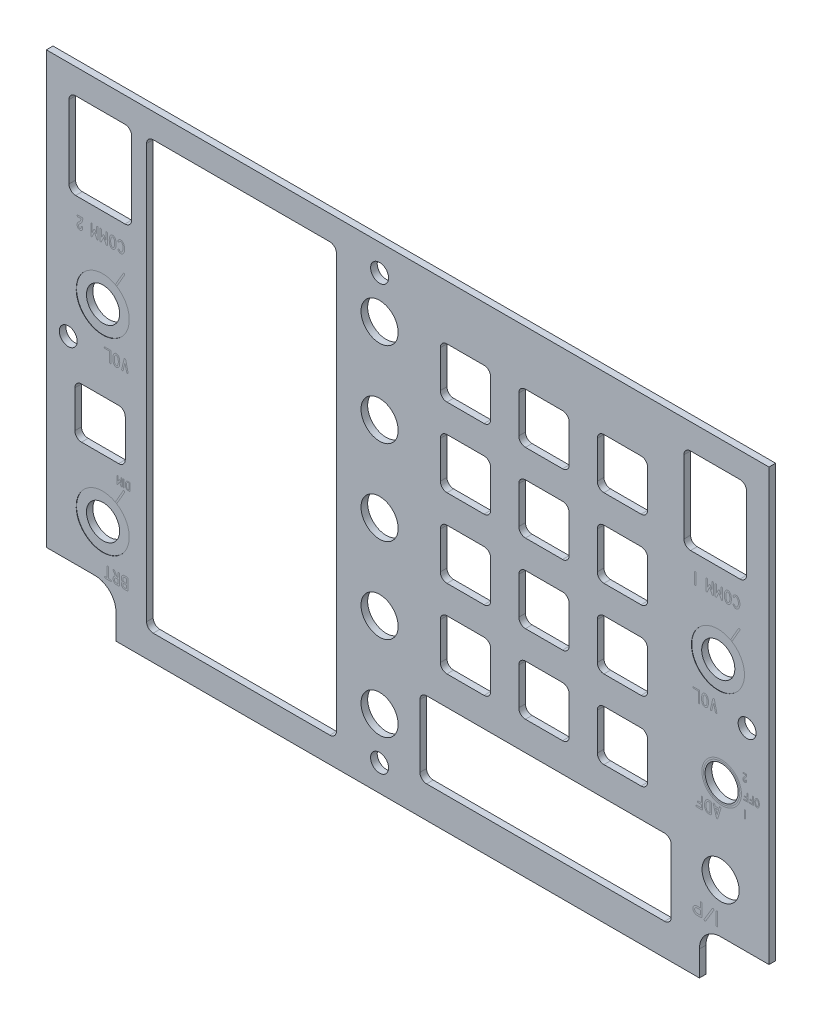
from build123d import *

# Parameters (mm, degrees)
BOSS_EXTRUDE1_DEPTH   = 1.5875
SKETCH3_R             = 4.445
SKETCH3_W             = 12.065
SKETCH3_H             = 12.065
CUT_EXTRUDE1_DEPTH    = 202.731272774
SKETCH4_R             = 3.96875
CUT_EXTRUDE2_DEPTH    = 202.731272774
SKETCH5_W             = 11.94
SKETCH5_H             = 20.64
SKETCH5_W_2           = 45.462
SKETCH5_H_2           = 102.32
SKETCH5_W_3           = 60.175
SKETCH5_H_3           = 18.275
CUT_EXTRUDE3_DEPTH    = 202.731272774
F_6_CLEARANCE_HOLE2_D = 4.3053
CUT_EXTRUDE4_START    = -1.5875
SKETCH11_W            = 15
SKETCH11_H            = 20.64
CUT_EXTRUDE4_DEPTH    = 1.5875
CUT_EXTRUDE6_START    = -0.033045
SKETCH13_W            = 15
SKETCH13_H            = 1.5875
CUT_EXTRUDE6_DEPTH    = 0.033045
FILLET1_START         = -0.0762
FILLET1_OUTLINE_R     = 6.35
FILLET1_OUTLINE_R_2   = 3.96875
FILLET1_DEPTH         = 0.0762
FILLET1_START_2       = -1.5875
FILLET1_2_DEPTH       = 1.5875


with BuildPart() as part:
    # Sketch1 → Boss-Extrude1 (new body)
    with BuildSketch(Plane.XY):
        with BuildLine():
            Line((74.93, -171.1167297), (86.51875, -171.1167297))
            Line((86.51875, -171.1167297), (86.51875, -67.9292297))
            Line((86.51875, -67.9292297), (-86.51875, -67.9292297))
            Line((-86.51875, -67.9292297), (-86.51875, -171.1167297))
            Line((-86.51875, -171.1167297), (-74.93, -171.1167297))
            ThreePointArc((-74.93, -171.1167297), (-71.337897552, -172.604627251), (-69.85, -176.1967297))
            Line((-69.85, -176.1967297), (-69.85, -182.2292297))
            Line((-69.85, -182.2292297), (69.85, -182.2292297))
            Line((69.85, -182.2292297), (69.85, -176.1967297))
            ThreePointArc((69.85, -176.1967297), (71.337897552, -172.604627251), (74.93, -171.1167297))
        make_face()
    extrude(amount=-BOSS_EXTRUDE1_DEPTH)

    # Sketch3 → Cut-Extrude1 (cut, through all)
    with BuildSketch(Plane.XY):
        with Locations((74.93, -159.3692297)):
            Circle(SKETCH3_R)
        with Locations((-6.731, -165.7192297)):
            Circle(SKETCH3_R)
        with Locations((-6.731, -145.3992297)):
            Circle(SKETCH3_R)
        with Locations((-6.731, -125.0792297)):
            Circle(SKETCH3_R)
        with Locations((-6.731, -104.7592297)):
            Circle(SKETCH3_R)
        with Locations((-6.731, -84.4392297)):
            Circle(SKETCH3_R)
        with Locations((-73.66, -139.0492297)):
            Rectangle(SKETCH3_W, SKETCH3_H)
        with Locations((13.843, -143.3672297)):
            Rectangle(SKETCH3_W, SKETCH3_H)
        with Locations((32.639, -143.3672297)):
            Rectangle(SKETCH3_W, SKETCH3_H)
        with Locations((51.435, -143.3672297)):
            Rectangle(SKETCH3_W, SKETCH3_H)
        with Locations((51.435, -124.5712297)):
            Rectangle(SKETCH3_W, SKETCH3_H)
        with Locations((32.639, -124.5712297)):
            Rectangle(SKETCH3_W, SKETCH3_H)
        with Locations((13.843, -124.5712297)):
            Rectangle(SKETCH3_W, SKETCH3_H)
        with Locations((13.843, -105.7752297)):
            Rectangle(SKETCH3_W, SKETCH3_H)
        with Locations((13.843, -86.9792297)):
            Rectangle(SKETCH3_W, SKETCH3_H)
        with Locations((32.639, -86.9792297)):
            Rectangle(SKETCH3_W, SKETCH3_H)
        with Locations((32.639, -105.7752297)):
            Rectangle(SKETCH3_W, SKETCH3_H)
        with Locations((51.435, -105.7752297)):
            Rectangle(SKETCH3_W, SKETCH3_H)
        with Locations((51.435, -86.9792297)):
            Rectangle(SKETCH3_W, SKETCH3_H)
    extrude(amount=-CUT_EXTRUDE1_DEPTH, mode=Mode.SUBTRACT)

    # Sketch4 → Cut-Extrude2 (cut, through all)
    with BuildSketch(Plane.XY):
        with Locations((-73.025, -113.9667297)):
            Circle(SKETCH4_R)
        with Locations((-73.025, -159.0517297)):
            Circle(SKETCH4_R)
        with Locations((74.295, -113.9667297)):
            Circle(SKETCH4_R)
        with Locations((75.184, -139.0492297)):
            Circle(SKETCH4_R)
    extrude(amount=-CUT_EXTRUDE2_DEPTH, mode=Mode.SUBTRACT)

    # Sketch5 → Cut-Extrude3 (cut, through all)
    with BuildSketch(Plane.XY):
        with Locations((-73.66, -84.3122297)):
            Rectangle(SKETCH5_W, SKETCH5_H)
        with Locations((73.66, -84.3122297)):
            Rectangle(SKETCH5_W, SKETCH5_H)
        with Locations((-39.799, -124.9522297)):
            Rectangle(SKETCH5_W_2, SKETCH5_H_2)
        with Locations((33.02, -165.4922297)):
            Rectangle(SKETCH5_W_3, SKETCH5_H_3)
    extrude(amount=-CUT_EXTRUDE3_DEPTH, mode=Mode.SUBTRACT)

    # #6 Clearance Hole2 (through all)
    with Locations(Plane(origin=(0, 0, 0), x_dir=(-1, 0, 0), z_dir=(0, 0, 1))):
        with Locations((-81.28, 124.6982297), (6.731, 175.8792297), (81.28, 124.6982297), (6.731, 74.2792297)):
            Hole(F_6_CLEARANCE_HOLE2_D / 2)

    # Sketch11 → Cut-Extrude4 (cut)
    with BuildSketch(Plane(origin=(0, 0, -1.5875), x_dir=(-1, 0, 0), z_dir=(0, 0, -1)).offset(CUT_EXTRUDE4_START)):
        with Locations((73.612537257, -84.279184845)):
            Rectangle(SKETCH11_W, SKETCH11_H)
        with Locations((-73.648214902, -84.3122297)):
            Rectangle(SKETCH11_W, SKETCH11_H)
    extrude(amount=CUT_EXTRUDE4_DEPTH, mode=Mode.SUBTRACT)

    # Sketch13 → Cut-Extrude6 (cut)
    with BuildSketch(Plane(origin=(0, -94.599184845, 0), x_dir=(1, 0, 0), z_dir=(0, 1, 0)).offset(CUT_EXTRUDE6_START)):
        with Locations((-73.612537257, 0.79375)):
            Rectangle(SKETCH13_W, SKETCH13_H)
    extrude(amount=CUT_EXTRUDE6_DEPTH, mode=Mode.SUBTRACT)

    # Fillet1: read off the stored shape, not the designer's step
    # Fillet1 outline → Fillet1 (cut)
    # profile 1 of 3: a face of its own
    with BuildSketch(Plane.XY.offset(FILLET1_START)):
        with Locations((74.295, -113.9667297)):
            Circle(FILLET1_OUTLINE_R)
        with Locations((74.295, -113.9667297)):
            Circle(FILLET1_OUTLINE_R_2, mode=Mode.SUBTRACT)
    # profile 2 of 3: a face of its own
    with BuildSketch(Plane.XY.offset(FILLET1_START)):
        with Locations((-73.025, -159.0517297)):
            Circle(FILLET1_OUTLINE_R)
        with Locations((-73.025, -159.0517297)):
            Circle(FILLET1_OUTLINE_R_2, mode=Mode.SUBTRACT)
    # profile 3 of 3: a face of its own
    with BuildSketch(Plane.XY.offset(FILLET1_START)):
        with Locations((-73.025, -113.9667297)):
            Circle(FILLET1_OUTLINE_R)
        with Locations((-73.025, -113.9667297)):
            Circle(FILLET1_OUTLINE_R_2, mode=Mode.SUBTRACT)
    extrude(amount=FILLET1_DEPTH, mode=Mode.SUBTRACT)

    # Fillet1 2 outline → Fillet1 2 (add)
    with BuildSketch(Plane.XY.offset(FILLET1_START_2)):
        with BuildLine():
            Line((63.1075, -174.6297297), (63.1075, -173.0422297))
            ThreePointArc((63.1075, -173.0422297), (62.642532015, -174.164761715), (61.52, -174.6297297))
            Line((61.52, -174.6297297), (63.1075, -174.6297297))
        make_face()
        with BuildLine():
            ThreePointArc((61.52, -156.3547297), (62.642532015, -156.819697685), (63.1075, -157.9422297))
            Line((63.1075, -157.9422297), (63.1075, -156.3547297))
            Line((63.1075, -156.3547297), (61.52, -156.3547297))
        make_face()
        with BuildLine():
            Line((2.9325, -174.6297297), (4.52, -174.6297297))
            ThreePointArc((4.52, -174.6297297), (3.397467985, -174.164761715), (2.9325, -173.0422297))
            Line((2.9325, -173.0422297), (2.9325, -174.6297297))
        make_face()
        with BuildLine():
            ThreePointArc((2.9325, -157.9422297), (3.397467985, -156.819697685), (4.52, -156.3547297))
            Line((4.52, -156.3547297), (2.9325, -156.3547297))
            Line((2.9325, -156.3547297), (2.9325, -157.9422297))
        make_face()
        with BuildLine():
            Line((-79.6925, -145.0817297), (-78.105, -145.0817297))
            ThreePointArc((-78.105, -145.0817297), (-79.227532015, -144.616761715), (-79.6925, -143.4942297))
            Line((-79.6925, -143.4942297), (-79.6925, -145.0817297))
        make_face()
        with BuildLine():
            ThreePointArc((-67.6275, -143.4942297), (-68.092467985, -144.616761715), (-69.215, -145.0817297))
            Line((-69.215, -145.0817297), (-67.6275, -145.0817297))
            Line((-67.6275, -145.0817297), (-67.6275, -143.4942297))
        make_face()
        with BuildLine():
            Line((-79.6925, -133.0167297), (-79.6925, -134.6042297))
            ThreePointArc((-79.6925, -134.6042297), (-79.227532015, -133.481697685), (-78.105, -133.0167297))
            Line((-78.105, -133.0167297), (-79.6925, -133.0167297))
        make_face()
        with BuildLine():
            ThreePointArc((-69.215, -133.0167297), (-68.092467985, -133.481697685), (-67.6275, -134.6042297))
            Line((-67.6275, -134.6042297), (-67.6275, -133.0167297))
            Line((-67.6275, -133.0167297), (-69.215, -133.0167297))
        make_face()
        with BuildLine():
            ThreePointArc((-67.700037257, -73.959184845), (-66.577505242, -74.42415283), (-66.112537257, -75.546684845))
            Line((-66.112537257, -75.546684845), (-66.112537257, -73.959184845))
            Line((-66.112537257, -73.959184845), (-67.700037257, -73.959184845))
        make_face()
        with BuildLine():
            Line((-66.112537257, -94.6322297), (-66.112537257, -93.0447297))
            ThreePointArc((-66.112537257, -93.0447297), (-66.577505242, -94.167261715), (-67.700037257, -94.6322297))
            Line((-67.700037257, -94.6322297), (-66.112537257, -94.6322297))
        make_face()
        with BuildLine():
            ThreePointArc((-81.112537257, -75.546684845), (-80.647569272, -74.42415283), (-79.525037257, -73.959184845))
            Line((-79.525037257, -73.959184845), (-81.112537257, -73.959184845))
            Line((-81.112537257, -73.959184845), (-81.112537257, -75.546684845))
        make_face()
        with BuildLine():
            Line((-81.112537257, -94.6322297), (-79.525037257, -94.6322297))
            ThreePointArc((-79.525037257, -94.6322297), (-80.647569272, -94.167261715), (-81.112537257, -93.0447297))
            Line((-81.112537257, -93.0447297), (-81.112537257, -94.6322297))
        make_face()
        with BuildLine():
            ThreePointArc((79.560714902, -73.9922297), (80.683246917, -74.457197685), (81.148214902, -75.5797297))
            Line((81.148214902, -75.5797297), (81.148214902, -73.9922297))
            Line((81.148214902, -73.9922297), (79.560714902, -73.9922297))
        make_face()
        with BuildLine():
            Line((81.148214902, -94.6322297), (81.148214902, -93.0447297))
            ThreePointArc((81.148214902, -93.0447297), (80.683246917, -94.167261715), (79.560714902, -94.6322297))
            Line((79.560714902, -94.6322297), (81.148214902, -94.6322297))
        make_face()
        with BuildLine():
            ThreePointArc((66.148214902, -75.5797297), (66.613182887, -74.457197685), (67.735714902, -73.9922297))
            Line((67.735714902, -73.9922297), (66.148214902, -73.9922297))
            Line((66.148214902, -73.9922297), (66.148214902, -75.5797297))
        make_face()
        with BuildLine():
            Line((66.148214902, -94.6322297), (67.735714902, -94.6322297))
            ThreePointArc((67.735714902, -94.6322297), (66.613182887, -94.167261715), (66.148214902, -93.0447297))
            Line((66.148214902, -93.0447297), (66.148214902, -94.6322297))
        make_face()
        with BuildLine():
            Line((7.8105, -137.3347297), (7.8105, -138.9222297))
            ThreePointArc((7.8105, -138.9222297), (8.275467985, -137.799697685), (9.398, -137.3347297))
            Line((9.398, -137.3347297), (7.8105, -137.3347297))
        make_face()
        with BuildLine():
            ThreePointArc((9.398, -149.3997297), (8.275467985, -148.934761715), (7.8105, -147.8122297))
            Line((7.8105, -147.8122297), (7.8105, -149.3997297))
            Line((7.8105, -149.3997297), (9.398, -149.3997297))
        make_face()
        with BuildLine():
            Line((19.8755, -137.3347297), (18.288, -137.3347297))
            ThreePointArc((18.288, -137.3347297), (19.410532015, -137.799697685), (19.8755, -138.9222297))
            Line((19.8755, -138.9222297), (19.8755, -137.3347297))
        make_face()
        with BuildLine():
            ThreePointArc((19.8755, -147.8122297), (19.410532015, -148.934761715), (18.288, -149.3997297))
            Line((18.288, -149.3997297), (19.8755, -149.3997297))
            Line((19.8755, -149.3997297), (19.8755, -147.8122297))
        make_face()
        with BuildLine():
            Line((26.6065, -137.3347297), (26.6065, -138.9222297))
            ThreePointArc((26.6065, -138.9222297), (27.071467985, -137.799697685), (28.194, -137.3347297))
            Line((28.194, -137.3347297), (26.6065, -137.3347297))
        make_face()
        with BuildLine():
            ThreePointArc((28.194, -149.3997297), (27.071467985, -148.934761715), (26.6065, -147.8122297))
            Line((26.6065, -147.8122297), (26.6065, -149.3997297))
            Line((26.6065, -149.3997297), (28.194, -149.3997297))
        make_face()
        with BuildLine():
            Line((38.6715, -137.3347297), (37.084, -137.3347297))
            ThreePointArc((37.084, -137.3347297), (38.206532015, -137.799697685), (38.6715, -138.9222297))
            Line((38.6715, -138.9222297), (38.6715, -137.3347297))
        make_face()
        with BuildLine():
            ThreePointArc((38.6715, -147.8122297), (38.206532015, -148.934761715), (37.084, -149.3997297))
            Line((37.084, -149.3997297), (38.6715, -149.3997297))
            Line((38.6715, -149.3997297), (38.6715, -147.8122297))
        make_face()
        with BuildLine():
            Line((57.4675, -149.3997297), (57.4675, -147.8122297))
            ThreePointArc((57.4675, -147.8122297), (57.002532015, -148.934761715), (55.88, -149.3997297))
            Line((55.88, -149.3997297), (57.4675, -149.3997297))
        make_face()
        with BuildLine():
            ThreePointArc((55.88, -137.3347297), (57.002532015, -137.799697685), (57.4675, -138.9222297))
            Line((57.4675, -138.9222297), (57.4675, -137.3347297))
            Line((57.4675, -137.3347297), (55.88, -137.3347297))
        make_face()
        with BuildLine():
            Line((45.4025, -149.3997297), (46.99, -149.3997297))
            ThreePointArc((46.99, -149.3997297), (45.867467985, -148.934761715), (45.4025, -147.8122297))
            Line((45.4025, -147.8122297), (45.4025, -149.3997297))
        make_face()
        with BuildLine():
            ThreePointArc((45.4025, -138.9222297), (45.867467985, -137.799697685), (46.99, -137.3347297))
            Line((46.99, -137.3347297), (45.4025, -137.3347297))
            Line((45.4025, -137.3347297), (45.4025, -138.9222297))
        make_face()
        with BuildLine():
            Line((7.8105, -118.5387297), (7.8105, -120.1262297))
            ThreePointArc((7.8105, -120.1262297), (8.275467985, -119.003697685), (9.398, -118.5387297))
            Line((9.398, -118.5387297), (7.8105, -118.5387297))
        make_face()
        with BuildLine():
            ThreePointArc((9.398, -130.6037297), (8.275467985, -130.138761715), (7.8105, -129.0162297))
            Line((7.8105, -129.0162297), (7.8105, -130.6037297))
            Line((7.8105, -130.6037297), (9.398, -130.6037297))
        make_face()
        with BuildLine():
            Line((19.8755, -118.5387297), (18.288, -118.5387297))
            ThreePointArc((18.288, -118.5387297), (19.410532015, -119.003697685), (19.8755, -120.1262297))
            Line((19.8755, -120.1262297), (19.8755, -118.5387297))
        make_face()
        with BuildLine():
            ThreePointArc((19.8755, -129.0162297), (19.410532015, -130.138761715), (18.288, -130.6037297))
            Line((18.288, -130.6037297), (19.8755, -130.6037297))
            Line((19.8755, -130.6037297), (19.8755, -129.0162297))
        make_face()
        with BuildLine():
            Line((26.6065, -118.5387297), (26.6065, -120.1262297))
            ThreePointArc((26.6065, -120.1262297), (27.071467985, -119.003697685), (28.194, -118.5387297))
            Line((28.194, -118.5387297), (26.6065, -118.5387297))
        make_face()
        with BuildLine():
            ThreePointArc((28.194, -130.6037297), (27.071467985, -130.138761715), (26.6065, -129.0162297))
            Line((26.6065, -129.0162297), (26.6065, -130.6037297))
            Line((26.6065, -130.6037297), (28.194, -130.6037297))
        make_face()
        with BuildLine():
            Line((38.6715, -118.5387297), (37.084, -118.5387297))
            ThreePointArc((37.084, -118.5387297), (38.206532015, -119.003697685), (38.6715, -120.1262297))
            Line((38.6715, -120.1262297), (38.6715, -118.5387297))
        make_face()
        with BuildLine():
            ThreePointArc((38.6715, -129.0162297), (38.206532015, -130.138761715), (37.084, -130.6037297))
            Line((37.084, -130.6037297), (38.6715, -130.6037297))
            Line((38.6715, -130.6037297), (38.6715, -129.0162297))
        make_face()
        with BuildLine():
            Line((45.4025, -118.5387297), (45.4025, -120.1262297))
            ThreePointArc((45.4025, -120.1262297), (45.867467985, -119.003697685), (46.99, -118.5387297))
            Line((46.99, -118.5387297), (45.4025, -118.5387297))
        make_face()
        with BuildLine():
            ThreePointArc((46.99, -130.6037297), (45.867467985, -130.138761715), (45.4025, -129.0162297))
            Line((45.4025, -129.0162297), (45.4025, -130.6037297))
            Line((45.4025, -130.6037297), (46.99, -130.6037297))
        make_face()
        with BuildLine():
            Line((57.4675, -118.5387297), (55.88, -118.5387297))
            ThreePointArc((55.88, -118.5387297), (57.002532015, -119.003697685), (57.4675, -120.1262297))
            Line((57.4675, -120.1262297), (57.4675, -118.5387297))
        make_face()
        with BuildLine():
            ThreePointArc((57.4675, -129.0162297), (57.002532015, -130.138761715), (55.88, -130.6037297))
            Line((55.88, -130.6037297), (57.4675, -130.6037297))
            Line((57.4675, -130.6037297), (57.4675, -129.0162297))
        make_face()
        with BuildLine():
            Line((7.8105, -99.7427297), (7.8105, -101.3302297))
            ThreePointArc((7.8105, -101.3302297), (8.275467985, -100.207697685), (9.398, -99.7427297))
            Line((9.398, -99.7427297), (7.8105, -99.7427297))
        make_face()
        with BuildLine():
            ThreePointArc((9.398, -111.8077297), (8.275467985, -111.342761715), (7.8105, -110.2202297))
            Line((7.8105, -110.2202297), (7.8105, -111.8077297))
            Line((7.8105, -111.8077297), (9.398, -111.8077297))
        make_face()
        with BuildLine():
            Line((19.8755, -99.7427297), (18.288, -99.7427297))
            ThreePointArc((18.288, -99.7427297), (19.410532015, -100.207697685), (19.8755, -101.3302297))
            Line((19.8755, -101.3302297), (19.8755, -99.7427297))
        make_face()
        with BuildLine():
            ThreePointArc((19.8755, -110.2202297), (19.410532015, -111.342761715), (18.288, -111.8077297))
            Line((18.288, -111.8077297), (19.8755, -111.8077297))
            Line((19.8755, -111.8077297), (19.8755, -110.2202297))
        make_face()
        with BuildLine():
            Line((26.6065, -99.7427297), (26.6065, -101.3302297))
            ThreePointArc((26.6065, -101.3302297), (27.071467985, -100.207697685), (28.194, -99.7427297))
            Line((28.194, -99.7427297), (26.6065, -99.7427297))
        make_face()
        with BuildLine():
            ThreePointArc((28.194, -111.8077297), (27.071467985, -111.342761715), (26.6065, -110.2202297))
            Line((26.6065, -110.2202297), (26.6065, -111.8077297))
            Line((26.6065, -111.8077297), (28.194, -111.8077297))
        make_face()
        with BuildLine():
            Line((38.6715, -99.7427297), (37.084, -99.7427297))
            ThreePointArc((37.084, -99.7427297), (38.206532015, -100.207697685), (38.6715, -101.3302297))
            Line((38.6715, -101.3302297), (38.6715, -99.7427297))
        make_face()
        with BuildLine():
            ThreePointArc((38.6715, -110.2202297), (38.206532015, -111.342761715), (37.084, -111.8077297))
            Line((37.084, -111.8077297), (38.6715, -111.8077297))
            Line((38.6715, -111.8077297), (38.6715, -110.2202297))
        make_face()
        with BuildLine():
            Line((45.4025, -99.7427297), (45.4025, -101.3302297))
            ThreePointArc((45.4025, -101.3302297), (45.867467985, -100.207697685), (46.99, -99.7427297))
            Line((46.99, -99.7427297), (45.4025, -99.7427297))
        make_face()
        with BuildLine():
            ThreePointArc((46.99, -111.8077297), (45.867467985, -111.342761715), (45.4025, -110.2202297))
            Line((45.4025, -110.2202297), (45.4025, -111.8077297))
            Line((45.4025, -111.8077297), (46.99, -111.8077297))
        make_face()
        with BuildLine():
            Line((57.4675, -99.7427297), (55.88, -99.7427297))
            ThreePointArc((55.88, -99.7427297), (57.002532015, -100.207697685), (57.4675, -101.3302297))
            Line((57.4675, -101.3302297), (57.4675, -99.7427297))
        make_face()
        with BuildLine():
            ThreePointArc((57.4675, -110.2202297), (57.002532015, -111.342761715), (55.88, -111.8077297))
            Line((55.88, -111.8077297), (57.4675, -111.8077297))
            Line((57.4675, -111.8077297), (57.4675, -110.2202297))
        make_face()
        with BuildLine():
            Line((7.8105, -80.9467297), (7.8105, -82.5342297))
            ThreePointArc((7.8105, -82.5342297), (8.275467985, -81.411697685), (9.398, -80.9467297))
            Line((9.398, -80.9467297), (7.8105, -80.9467297))
        make_face()
        with BuildLine():
            ThreePointArc((9.398, -93.0117297), (8.275467985, -92.546761715), (7.8105, -91.4242297))
            Line((7.8105, -91.4242297), (7.8105, -93.0117297))
            Line((7.8105, -93.0117297), (9.398, -93.0117297))
        make_face()
        with BuildLine():
            Line((19.8755, -80.9467297), (18.288, -80.9467297))
            ThreePointArc((18.288, -80.9467297), (19.410532015, -81.411697685), (19.8755, -82.5342297))
            Line((19.8755, -82.5342297), (19.8755, -80.9467297))
        make_face()
        with BuildLine():
            ThreePointArc((19.8755, -91.4242297), (19.410532015, -92.546761715), (18.288, -93.0117297))
            Line((18.288, -93.0117297), (19.8755, -93.0117297))
            Line((19.8755, -93.0117297), (19.8755, -91.4242297))
        make_face()
        with BuildLine():
            Line((26.6065, -80.9467297), (26.6065, -82.5342297))
            ThreePointArc((26.6065, -82.5342297), (27.071467985, -81.411697685), (28.194, -80.9467297))
            Line((28.194, -80.9467297), (26.6065, -80.9467297))
        make_face()
        with BuildLine():
            ThreePointArc((28.194, -93.0117297), (27.071467985, -92.546761715), (26.6065, -91.4242297))
            Line((26.6065, -91.4242297), (26.6065, -93.0117297))
            Line((26.6065, -93.0117297), (28.194, -93.0117297))
        make_face()
        with BuildLine():
            Line((38.6715, -80.9467297), (37.084, -80.9467297))
            ThreePointArc((37.084, -80.9467297), (38.206532015, -81.411697685), (38.6715, -82.5342297))
            Line((38.6715, -82.5342297), (38.6715, -80.9467297))
        make_face()
        with BuildLine():
            ThreePointArc((38.6715, -91.4242297), (38.206532015, -92.546761715), (37.084, -93.0117297))
            Line((37.084, -93.0117297), (38.6715, -93.0117297))
            Line((38.6715, -93.0117297), (38.6715, -91.4242297))
        make_face()
        with BuildLine():
            Line((45.4025, -80.9467297), (45.4025, -82.5342297))
            ThreePointArc((45.4025, -82.5342297), (45.867467985, -81.411697685), (46.99, -80.9467297))
            Line((46.99, -80.9467297), (45.4025, -80.9467297))
        make_face()
        with BuildLine():
            ThreePointArc((46.99, -93.0117297), (45.867467985, -92.546761715), (45.4025, -91.4242297))
            Line((45.4025, -91.4242297), (45.4025, -93.0117297))
            Line((45.4025, -93.0117297), (46.99, -93.0117297))
        make_face()
        with BuildLine():
            Line((57.4675, -80.9467297), (55.88, -80.9467297))
            ThreePointArc((55.88, -80.9467297), (57.002532015, -81.411697685), (57.4675, -82.5342297))
            Line((57.4675, -82.5342297), (57.4675, -80.9467297))
        make_face()
        with BuildLine():
            ThreePointArc((57.4675, -91.4242297), (57.002532015, -92.546761715), (55.88, -93.0117297))
            Line((55.88, -93.0117297), (57.4675, -93.0117297))
            Line((57.4675, -93.0117297), (57.4675, -91.4242297))
        make_face()
        with BuildLine():
            Line((-17.068, -73.7922297), (-18.6555, -73.7922297))
            ThreePointArc((-18.6555, -73.7922297), (-17.532967985, -74.257197685), (-17.068, -75.3797297))
            Line((-17.068, -75.3797297), (-17.068, -73.7922297))
        make_face()
        with BuildLine():
            ThreePointArc((-62.53, -75.3797297), (-62.065032015, -74.257197685), (-60.9425, -73.7922297))
            Line((-60.9425, -73.7922297), (-62.53, -73.7922297))
            Line((-62.53, -73.7922297), (-62.53, -75.3797297))
        make_face()
        with BuildLine():
            Line((-17.068, -176.1122297), (-17.068, -174.5247297))
            ThreePointArc((-17.068, -174.5247297), (-17.532967985, -175.647261715), (-18.6555, -176.1122297))
            Line((-18.6555, -176.1122297), (-17.068, -176.1122297))
        make_face()
        with BuildLine():
            ThreePointArc((-60.9425, -176.1122297), (-62.065032015, -175.647261715), (-62.53, -174.5247297))
            Line((-62.53, -174.5247297), (-62.53, -176.1122297))
            Line((-62.53, -176.1122297), (-60.9425, -176.1122297))
        make_face()
    extrude(amount=FILLET1_2_DEPTH)


solid = part.part
